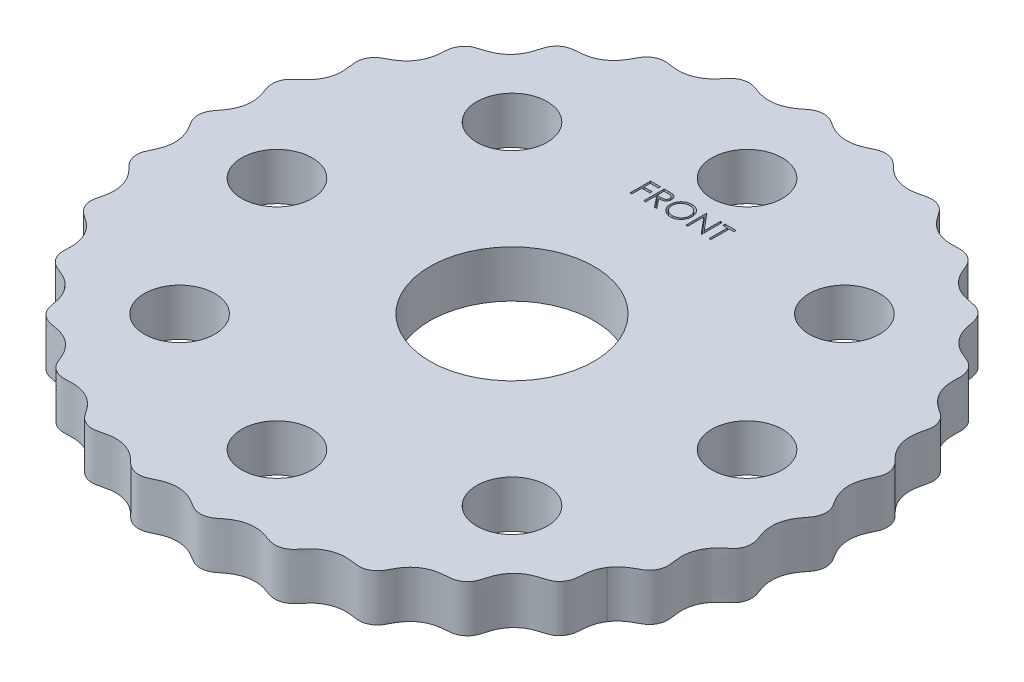
from build123d import *

# Parameters (mm, degrees)
BOSS_EXTRUDE1_DEPTH = 8
SKETCH3_R           = 13.975
SKETCH3_R_2         = 6
CUT_EXTRUDE1_DEPTH  = 80.602111677
CUT_EXTRUDE2_DEPTH  = 1


with BuildPart() as part:
    # Boss-Extrude1: read off the stored shape, not the designer's step
    # Boss-Extrude1 outline → Boss-Extrude1 (new body)
    with BuildSketch(Plane(origin=(0, 0, 0), x_dir=(1, 0, 0), z_dir=(0, 1, 0))):
        with BuildLine():
            add(Edge.make_bspline(
                [(45.452011393, -29.295396999), (45.482020207, -29.248838676), (45.539950378, -29.162318364), (45.690793525, -28.948505321), (45.945860987, -28.623186457), (46.519930798, -28.011988654), (47.291652745, -27.440896957), (48.131923542, -26.977086828), (48.780086514, -26.645059788), (49.38776392, -26.211455603), (50.035613, -25.454884874), (50.494850475, -24.256065773), (50.276789439, -22.77633474), (50.104474336, -21.357743007), (50.269796954, -19.920016676), (50.769712821, -18.569861894), (51.582970862, -17.373442214), (52.638109876, -16.40818839), (53.798010715, -15.474073004), (54.398237755, -14.052797744), (54.288242379, -12.788844058), (53.936943004, -11.878053184), (53.691639282, -11.201454425), (53.502016764, -10.508166169), (53.348681094, -9.563709411), (53.365752469, -8.362214318), (53.736623243, -6.967831783), (54.311860092, -5.913554711), (54.883090058, -5.142725575), (55.340751713, -4.578997497), (55.737538775, -3.949015301), (56.052730778, -3.00188621), (56.025620148, -1.985315879), (55.649644456, -1.061104039), (55.122864038, -0.240134624), (54.500638717, 0.782820357), (54.044556858, 2.153494538), (53.928329594, 3.589569405), (54.163281961, 5.016105688), (54.712144707, 6.338029285), (55.412584997, 7.646381686), (55.437790296, 9.187808634), (54.735024872, 10.54181705), (53.639118394, 11.510323523), (52.771830413, 12.658437238), (52.180323553, 13.974054615), (51.929405012, 15.394952627), (52.007688372, 16.593339305), (52.206190075, 17.531817872), (52.394523489, 18.231098314), (52.520927557, 18.962794769), (52.455506926, 19.959202548), (52.045558264, 20.889312064), (51.348722995, 21.604575131), (50.537370244, 22.152468312), (49.543409202, 22.819381701), (48.553261077, 23.871542755), (47.841768495, 25.124517383), (47.455397201, 26.517005342), (47.394149547, 27.948505123), (47.52261616, 29.422226755), (46.968961031, 30.857027514), (45.808285231, 31.8535888), (44.408884991, 32.298430416), (43.140404019, 32.972958337), (42.048757909, 33.917677709), (41.224521321, 35.099939242), (40.696031584, 36.444617259), (40.51608949, 37.629027207), (40.301720063, 38.591301743), (39.864677347, 39.48992174), (39.133325258, 40.194876492), (38.218073131, 40.595606327), (37.253580175, 40.782846618), (36.071300828, 40.970873882), (34.730638, 41.509718514), (33.556725898, 42.345495693), (32.620960719, 43.445774876), (31.960045306, 44.719085871), (31.494328922, 46.117687905), (30.446430109, 47.237781564), (28.993407958, 47.72966066), (27.527409538, 47.575965637), (26.09477545, 47.65212614), (24.706256084, 48.049924523), (23.460272332, 48.773879165), (22.415834948, 49.772324046), (21.756309533, 50.771411807), (21.18743939, 51.572468485), (20.444467382, 52.240500735), (19.500388916, 52.615401554), (18.501488434, 52.642279486), (17.536585409, 52.440079118), (16.383589539, 52.114801947), (14.940682821, 52.040769245), (13.523552592, 52.303161906), (12.212320575, 52.907196355), (11.074130719, 53.783867641), (10.091039504, 54.874622372), (8.704064767, 55.520076288), (7.1686916, 55.431701854), (5.879593477, 54.706045456), (4.550582563, 54.170624607), (3.122828399, 53.947415169), (1.687859842, 54.077924066), (0.320695311, 54.545147358), (-0.697186076, 55.174948414), (-1.531265128, 55.687584796), (-2.470477662, 56.026791538), (-3.486865599, 56.015990022), (-4.421336869, 55.664035314), (-5.035502665, 55.246714903), (-5.594575696, 54.786390441), (-6.367297701, 54.218019531), (-7.426377738, 53.651796586), (-8.824065069, 53.293493528), (-10.266531357, 53.288855582), (-11.670341095, 53.604558747), (-13.005004357, 54.202638527), (-14.528387878, 54.283429423), (-15.921788506, 53.62383615), (-16.824045224, 52.445566546), (-17.80129743, 51.399751347), (-19.003455996, 50.596627626), (-20.359323515, 50.109373145), (-21.796017134, 49.958739694), (-22.984604633, 50.102696542), (-23.949938492, 50.243667024), (-24.94676167, 50.204247475), (-25.883921729, 49.809140233), (-26.616265738, 49.130849265), (-27.026032174, 48.509246894), (-27.350515124, 47.859681973), (-27.816620118, 47.021077593), (-28.539207375, 46.061783917), (-29.655952484, 45.148142237), (-30.743142683, 44.636385074), (-31.666616638, 44.385977082), (-32.376331518, 44.272346807), (-33.093840777, 44.216319001), (-34.068415009, 44.160093251), (-35.264956472, 43.738229889), (-36.31143808, 42.604577354), (-36.683107055, 41.162427233), (-37.126430474, 39.802832151), (-37.880177694, 38.568055674), (-38.903346828, 37.555159171), (-40.144455104, 36.810820906), (-41.507578213, 36.381880712), (-42.945266896, 35.969336398), (-43.847405921, 35.055934649), (-44.268863223, 34.153490056), (-44.412643136, 33.420966547), (-44.447421794, 32.693522882), (-44.522839391, 31.736704546), (-44.72421652, 30.798023635), (-45.043766236, 30.022778058), (-45.234706871, 29.65611949), (-45.367135582, 29.430438722), (-45.422004001, 29.341953117), (-45.452011393, 29.295396999)],
                knots=[0.068442981, 0.068442981, 0.068442981, 0.068442981, 0.069285866, 0.07012875, 0.07181452, 0.075186058, 0.081929134, 0.085300673, 0.088672211, 0.092043749, 0.095415287, 0.102158364, 0.108901441, 0.115644517, 0.122387594, 0.12913067, 0.135873747, 0.142616823, 0.1493599, 0.156102976, 0.162846053, 0.166217591, 0.16958913, 0.172960668, 0.176332206, 0.183075283, 0.189818359, 0.196561436, 0.199932974, 0.203304512, 0.206676051, 0.210047589, 0.216790665, 0.220162204, 0.223533742, 0.230276819, 0.237019895, 0.243762972, 0.250506048, 0.257249125, 0.263992201, 0.270735278, 0.277478354, 0.284221431, 0.290964507, 0.297707584, 0.304450661, 0.311193737, 0.314565275, 0.317936814, 0.321308352, 0.32467989, 0.331422967, 0.334794505, 0.338166043, 0.34490912, 0.351652196, 0.358395273, 0.36513835, 0.371881426, 0.378624503, 0.385367579, 0.392110656, 0.398853732, 0.405596809, 0.412339885, 0.419082962, 0.425826039, 0.432569115, 0.435940653, 0.439312192, 0.446055268, 0.449426806, 0.452798345, 0.459541421, 0.466284498, 0.473027574, 0.479770651, 0.486513728, 0.493256804, 0.499999881, 0.506742957, 0.513486034, 0.52022911, 0.526972187, 0.533715263, 0.54045834, 0.547201417, 0.550572955, 0.553944493, 0.56068757, 0.564059108, 0.567430646, 0.574173723, 0.580916799, 0.587659876, 0.594402952, 0.601146029, 0.607889105, 0.614632182, 0.621375259, 0.628118335, 0.634861412, 0.641604488, 0.648347565, 0.655090641, 0.661833718, 0.665205256, 0.668576794, 0.675319871, 0.678691409, 0.682062948, 0.685434486, 0.688806024, 0.695549101, 0.702292177, 0.709035254, 0.71577833, 0.722521407, 0.729264483, 0.73600756, 0.742750637, 0.749493713, 0.75623679, 0.762979866, 0.769722943, 0.776466019, 0.779837558, 0.783209096, 0.789952172, 0.793323711, 0.796695249, 0.800066787, 0.803438326, 0.810181402, 0.816924479, 0.823667555, 0.827039093, 0.830410632, 0.83378217, 0.837153708, 0.843896785, 0.850639861, 0.857382938, 0.864126014, 0.870869091, 0.877612168, 0.884355244, 0.891098321, 0.897841397, 0.904584474, 0.907956012, 0.91132755, 0.914699089, 0.918070627, 0.924813703, 0.928185242, 0.929871011, 0.930713895, 0.93155678, 0.93155678, 0.93155678, 0.93155678], degree=3))
            add(Edge.make_bspline(
                [(-45.452011393, 29.295396999), (-45.482019477, 29.248839248), (-45.539947367, 29.162321464), (-45.690789371, 28.948508087), (-45.945856792, 28.623185577), (-46.519925191, 28.011983666), (-47.29164202, 27.440909837), (-48.131898599, 26.977058013), (-48.780039576, 26.644946563), (-49.387785704, 26.21146236), (-50.035599368, 25.454911063), (-50.494864672, 24.256064691), (-50.276802503, 22.776339405), (-50.104483942, 21.357748296), (-50.269799242, 19.920021004), (-50.769708571, 18.569863596), (-51.582961228, 17.373440464), (-52.638095451, 16.408181099), (-53.797999989, 15.474072119), (-54.398238796, 14.052802493), (-54.28825513, 12.788847524), (-53.936957446, 11.878054287), (-53.691651941, 11.201457093), (-53.502026507, 10.508168452), (-53.348686936, 9.563713445), (-53.365751967, 8.362219919), (-53.736619759, 6.967831949), (-54.311850704, 5.913561542), (-54.883092063, 5.142721386), (-55.340657861, 4.578932289), (-55.737530279, 3.949018779), (-56.052801709, 3.001912614), (-56.025579494, 1.985232731), (-55.649781289, 1.061119393), (-55.122707794, 0.240184662), (-54.500715895, -0.782845267), (-54.044549214, -2.15349866), (-53.928335645, -3.589565496), (-54.16327507, -5.016098662), (-54.71212817, -6.338033079), (-55.412573612, -7.646377904), (-55.437792443, -9.187804363), (-54.735039287, -10.541820251), (-53.639131433, -11.510327741), (-52.771838332, -12.658436844), (-52.180325197, -13.974051598), (-51.929399778, -15.394948334), (-52.007677663, -16.593335373), (-52.20617624, -17.531814556), (-52.394509, -18.231094687), (-52.520917845, -18.962789716), (-52.455505526, -19.959198126), (-52.045564115, -20.889310697), (-51.348734806, -21.604579831), (-50.537383212, -22.152476419), (-49.5434193, -22.819385473), (-48.553266484, -23.87154217), (-47.841767661, -25.124513292), (-47.455390134, -26.516999321), (-47.394135138, -27.948499239), (-47.522605986, -29.422219141), (-46.968964082, -30.85702387), (-45.808296742, -31.853596764), (-44.408895402, -32.298440075), (-43.140411621, -32.972961507), (-42.04876098, -33.917675929), (-41.22451857, -35.09993334), (-40.696022967, -36.444609077), (-40.516076102, -37.629018061), (-40.301712357, -38.591292823), (-39.864677196, -39.48991668), (-39.133331122, -40.194876089), (-38.218081268, -40.595615448), (-37.253590114, -40.782858733), (-36.071306144, -40.970886443), (-34.730639182, -41.509731233), (-33.556721074, -42.345495536), (-32.620976154, -43.445773487), (-31.959938524, -44.719063945), (-31.494447944, -46.117669084), (-30.446365425, -47.237822981), (-28.993474039, -47.729559685), (-27.527385182, -47.576071566), (-26.094782881, -47.652112284), (-24.706254032, -48.049928597), (-23.460261037, -48.773872439), (-22.415825504, -49.772313607), (-21.756302398, -50.771397329), (-21.187434253, -51.572456885), (-20.444470002, -52.240495153), (-19.500393308, -52.615403393), (-18.501493228, -52.642289829), (-17.536588061, -52.44009475), (-16.383593294, -52.114812823), (-14.940686933, -52.040773813), (-13.523555358, -52.30315944), (-12.212320701, -52.907187688), (-11.07412608, -53.783853705), (-10.091036883, -54.874608128), (-8.704069276, -55.520074615), (-7.168694262, -55.431713954), (-5.879592797, -54.706060727), (-4.55058507, -54.170633211), (-3.122831736, -53.947417258), (-1.687862569, -54.077918973), (-0.320696001, -54.545136147), (0.697188163, -55.17493276), (1.53126456, -55.687571624), (2.470473996, -56.026786372), (3.486862141, -56.015992795), (4.42133629, -55.664045996), (5.035505387, -55.246729387), (5.594578429, -54.7864042), (6.367298562, -54.218030678), (7.426375978, -53.651802856), (8.824061607, -53.293492944), (10.266527679, -53.288848133), (11.670339516, -53.604544662), (13.005001256, -54.202623602), (14.528383006, -54.283428933), (15.921789742, -53.623847936), (16.824055556, -52.445579942), (17.801293851, -51.399760376), (19.003449862, -50.596623521), (20.359330313, -50.109378115), (21.796007811, -49.958658751), (22.984623467, -50.102859067), (23.949867836, -50.243548365), (24.946854017, -50.204249861), (25.883868277, -49.809086397), (26.616266038, -49.130858381), (27.026130366, -48.509305428), (27.350518172, -47.859678415), (27.816617782, -47.021088942), (28.539208609, -46.061787098), (29.655947461, -45.148144871), (30.743136422, -44.636381206), (31.666610338, -44.385968876), (32.37632365, -44.272336062), (33.09383359, -44.216305956), (34.068406349, -44.160082772), (35.264951533, -43.738230817), (36.311443319, -42.604586841), (36.683119802, -41.16243747), (37.126436071, -39.802840285), (37.880177826, -38.56806028), (38.90334177, -37.55515882), (40.144446079, -36.810814196), (41.507568283, -36.381870467), (42.945261745, -35.969322941), (43.847387605, -35.055957981), (44.268848121, -34.153473192), (44.412765821, -33.420962722), (44.447458549, -32.693533894), (44.522832253, -31.736719823), (44.724223439, -30.798026917), (45.043768778, -30.022781604), (45.234706012, -29.656124644), (45.367133838, -29.430442917), (45.422003637, -29.341954262), (45.452011393, -29.295396999)],
                knots=[0.068443102, 0.068443102, 0.068443102, 0.068443102, 0.069285987, 0.070128871, 0.07181464, 0.075186179, 0.081929255, 0.085300793, 0.088672332, 0.09204387, 0.095415408, 0.102158485, 0.108901561, 0.115644638, 0.122387714, 0.129130791, 0.135873867, 0.142616944, 0.14936002, 0.156103097, 0.162846174, 0.166217712, 0.16958925, 0.172960788, 0.176332327, 0.183075403, 0.18981848, 0.196561556, 0.199933094, 0.203304633, 0.206676171, 0.210047709, 0.216790786, 0.220162324, 0.223533862, 0.230276939, 0.237020015, 0.243763092, 0.250506168, 0.257249245, 0.263992322, 0.270735398, 0.277478475, 0.284221551, 0.290964628, 0.297707704, 0.304450781, 0.311193857, 0.314565395, 0.317936934, 0.321308472, 0.32468001, 0.331423087, 0.334794625, 0.338166163, 0.34490924, 0.351652316, 0.358395393, 0.365138469, 0.371881546, 0.378624623, 0.385367699, 0.392110776, 0.398853852, 0.405596929, 0.412340005, 0.419083082, 0.425826158, 0.432569235, 0.435940773, 0.439312311, 0.446055388, 0.449426926, 0.452798464, 0.459541541, 0.466284617, 0.473027694, 0.479770771, 0.486513847, 0.493256924, 0.5, 0.506743077, 0.513486153, 0.52022923, 0.526972306, 0.533715383, 0.540458459, 0.547201536, 0.550573074, 0.553944612, 0.560687689, 0.564059227, 0.567430765, 0.574173842, 0.580916918, 0.587659995, 0.594403072, 0.601146148, 0.607889225, 0.614632301, 0.621375378, 0.628118454, 0.634861531, 0.641604607, 0.648347684, 0.65509076, 0.661833837, 0.665205375, 0.668576913, 0.67531999, 0.678691528, 0.682063066, 0.685434605, 0.688806143, 0.69554922, 0.702292296, 0.709035373, 0.715778449, 0.722521526, 0.729264602, 0.736007679, 0.742750755, 0.749493832, 0.756236908, 0.762979985, 0.769723061, 0.776466138, 0.779837676, 0.783209214, 0.789952291, 0.793323829, 0.796695367, 0.800066906, 0.803438444, 0.810181521, 0.816924597, 0.823667674, 0.827039212, 0.83041075, 0.833782288, 0.837153827, 0.843896903, 0.85063998, 0.857383056, 0.864126133, 0.870869209, 0.877612286, 0.884355362, 0.891098439, 0.897841515, 0.904584592, 0.90795613, 0.911327669, 0.914699207, 0.918070745, 0.924813822, 0.92818536, 0.929871129, 0.930714014, 0.931556896, 0.931556896, 0.931556896, 0.931556896], degree=3))
        make_face()
    extrude(amount=BOSS_EXTRUDE1_DEPTH)

    # Sketch3 → Cut-Extrude1 (cut, through all)
    with BuildSketch(Plane(origin=(0, 8, 0), x_dir=(1, 0, 0), z_dir=(0, 1, 0))):
        with Locations(Location((0, 0, 0), (0, 0, 270))):
            Circle(SKETCH3_R)
        with Locations(Location((0, 40, 0), (0, 0, 270))):
            Circle(SKETCH3_R_2)
        with Locations(Location((28.284271247, 28.284271247, 0), (0, 0, 270))):
            Circle(SKETCH3_R_2)
        with Locations(Location((40, 0, 0), (0, 0, 270))):
            Circle(SKETCH3_R_2)
        with Locations(Location((28.284271247, -28.284271247, 0), (0, 0, 270))):
            Circle(SKETCH3_R_2)
        with Locations(Location((0, -40, 0), (0, 0, 270))):
            Circle(SKETCH3_R_2)
        with Locations(Location((-28.284271247, -28.284271247, 0), (0, 0, 270))):
            Circle(SKETCH3_R_2)
        with Locations(Location((-40, 0, 0), (0, 0, 270))):
            Circle(SKETCH3_R_2)
        with Locations(Location((-28.284271247, 28.284271247, 0), (0, 0, 270))):
            Circle(SKETCH3_R_2)
    extrude(amount=-CUT_EXTRUDE1_DEPTH, mode=Mode.SUBTRACT)

    # Sketch4 → Cut-Extrude2 (cut)
    # profile 1 of 5: a face of its own
    with BuildSketch(Plane(origin=(0, 8, 0), x_dir=(1, 0, 0), z_dir=(0, 1, 0))):
        Polygon((-7.786271951, 31.356243312), (-6.081143746, 31.356243312), (-6.081143746, 30.997268953), (-7.472169387, 30.997268953), (-7.472169387, 29.920345876), (-6.081143746, 29.920345876), (-6.081143746, 29.561371517), (-7.472169387, 29.561371517), (-7.472169387, 27.856243312), (-7.786271951, 27.856243312), align=None)
    # profile 2 of 5: a face of its own
    with BuildSketch(Plane(origin=(0, 8, 0), x_dir=(1, 0, 0), z_dir=(0, 1, 0))):
        with BuildLine():
            Line((-5.452938618, 31.356243312), (-4.752517944, 31.356243312))
            add(Edge.make_bspline(
                [(-4.752517944, 31.356243312), (-4.705776816, 31.356087726), (-4.616028672, 31.355788984), (-4.487455401, 31.354123221), (-4.370628304, 31.349348865), (-4.265608465, 31.345240282), (-4.17239781, 31.33774834), (-4.090710519, 31.330587693), (-4.020922822, 31.321214032), (-3.97867697, 31.312508609), (-3.959549194, 31.30856703)],
                knots=[0, 0, 0, 0, 1.410062039, 2.707475311, 3.878576406, 4.937260626, 5.877586885, 6.699081471, 7.410979367, 8, 8, 8, 8], degree=3))
            add(Edge.make_bspline(
                [(-3.959549194, 31.30856703), (-3.93394257, 31.302240265), (-3.883275581, 31.289721701), (-3.810325515, 31.2632621), (-3.740811191, 31.232642475), (-3.675021367, 31.196678755), (-3.613285575, 31.155103975), (-3.554967265, 31.108635853), (-3.499801801, 31.057528647), (-3.450020171, 31.000493806), (-3.403081119, 30.940657296), (-3.363492493, 30.875953539), (-3.329366013, 30.808292012), (-3.302195496, 30.736984594), (-3.280317523, 30.662722822), (-3.264891283, 30.584834025), (-3.255640096, 30.50367305), (-3.25469824, 30.448315141), (-3.254220669, 30.420245716)],
                knots=[0, 0, 0, 0, 1.027469482, 2.033020251, 3.019912614, 3.986113645, 4.951240523, 5.91722682, 6.890402269, 7.87763091, 8.8651537, 9.85103654, 10.82876324, 11.815024772, 12.821070561, 13.842952187, 14.906261191, 16, 16, 16, 16], degree=3))
            add(Edge.make_bspline(
                [(-3.254220669, 30.420245716), (-3.255689667, 30.373610611), (-3.258556063, 30.282613443), (-3.285281166, 30.150552562), (-3.329057686, 30.027363247), (-3.389380975, 29.913200609), (-3.466200451, 29.810289964), (-3.558525242, 29.719899509), (-3.666406853, 29.644259596), (-3.766836169, 29.591806791), (-3.855550369, 29.558213883), (-3.928583682, 29.534577524), (-4.008250659, 29.516315559), (-4.093787994, 29.499955427), (-4.185551649, 29.487603732), (-4.283321689, 29.478557138), (-4.38716784, 29.472903089), (-4.45850691, 29.472061084), (-4.495206246, 29.471627927)],
                knots=[0, 0, 0, 0, 1.260483769, 2.459530307, 3.627416485, 4.787058657, 5.939039949, 7.08810263, 8.267026773, 9.491475466, 10.141966685, 10.831826277, 11.566392101, 12.351337768, 13.187381173, 14.07005841, 15.007169909, 16, 16, 16, 16], degree=3))
            Line((-4.495206246, 29.471627927), (-3.209348874, 27.856243312))
            Line((-3.209348874, 27.856243312), (-3.597770348, 27.856243312))
            Line((-3.597770348, 27.856243312), (-4.88362772, 29.471627927))
            Line((-4.88362772, 29.471627927), (-5.138836053, 29.471627927))
            Line((-5.138836053, 29.471627927), (-5.138836053, 27.856243312))
            Line((-5.138836053, 27.856243312), (-5.452938618, 27.856243312))
            Line((-5.452938618, 27.856243312), (-5.452938618, 31.356243312))
        make_face()
        with BuildLine():
            Line((-5.138836053, 30.997268953), (-5.138836053, 29.830602286))
            Line((-5.138836053, 29.830602286), (-4.498010733, 29.825694434))
            add(Edge.make_bspline(
                [(-4.498010733, 29.825694434), (-4.468090694, 29.825681197), (-4.410097137, 29.825655541), (-4.326196472, 29.829649317), (-4.24807636, 29.834192635), (-4.176035608, 29.841141981), (-4.110042033, 29.850098052), (-4.05012862, 29.861301037), (-3.996197568, 29.874353099), (-3.933299029, 29.894554725), (-3.863062498, 29.926560743), (-3.786731038, 29.973126242), (-3.7217287, 30.031695361), (-3.666810838, 30.098668817), (-3.622681407, 30.172305066), (-3.591569352, 30.251721435), (-3.57182691, 30.334913033), (-3.569498365, 30.392091141), (-3.568323233, 30.420946838)],
                knots=[0, 0, 0, 0, 1.146690395, 2.22261258, 3.21895312, 4.145990853, 4.996080663, 5.770904154, 6.481378293, 7.121626537, 8.300444488, 9.431385265, 10.535395872, 11.636531494, 12.74115979, 13.810798291, 14.895190096, 16, 16, 16, 16], degree=3))
            add(Edge.make_bspline(
                [(-3.568323233, 30.420946838), (-3.569525354, 30.449093411), (-3.571907519, 30.50486965), (-3.591356288, 30.58652556), (-3.624245669, 30.66359251), (-3.668567907, 30.735756995), (-3.722567062, 30.801262731), (-3.785884875, 30.857309884), (-3.85679007, 30.903559349), (-3.923061268, 30.93311373), (-3.982295481, 30.951233583), (-4.033725141, 30.963984747), (-4.091836619, 30.974229215), (-4.156912077, 30.982437276), (-4.228673708, 30.989492221), (-4.307484359, 30.994243999), (-4.392821139, 30.997057863), (-4.451968071, 30.997196952), (-4.482586053, 30.997268953)],
                knots=[0, 0, 0, 0, 1.101028733, 2.181837193, 3.264309656, 4.369019818, 5.486613113, 6.575447106, 7.666700264, 8.788928104, 9.402425223, 10.0903467, 10.862060571, 11.710948788, 12.657782767, 13.684531032, 14.801375019, 16, 16, 16, 16], degree=3))
            Line((-4.482586053, 30.997268953), (-5.138836053, 30.997268953))
        make_face(mode=Mode.SUBTRACT)
    # profile 3 of 5: a face of its own
    with BuildSketch(Plane(origin=(0, 8, 0), x_dir=(1, 0, 0), z_dir=(0, 1, 0))):
        with BuildLine():
            add(Edge.make_bspline(
                [(-0.853579643, 31.445986902), (-0.788771537, 31.444345422), (-0.66148307, 31.441121421), (-0.474408173, 31.416442318), (-0.295813077, 31.373746928), (-0.124242939, 31.316883945), (0.038250038, 31.24102956), (0.192888931, 31.149344412), (0.339305804, 31.040867953), (0.475527186, 30.916438726), (0.600184136, 30.781055272), (0.710010022, 30.636577362), (0.802052316, 30.48387856), (0.877638103, 30.323417729), (0.936936713, 30.155557761), (0.977855757, 29.979403758), (1.003993907, 29.796097068), (1.007049684, 29.671070204), (1.008599844, 29.607645556)],
                knots=[0, 0, 0, 0, 1.065120563, 2.091984664, 3.0946048, 4.079830382, 5.057816894, 6.036188127, 7.030412546, 8.04752943, 9.064399622, 10.05169764, 11.02544977, 11.989514704, 12.962713494, 13.945757189, 14.957906945, 16, 16, 16, 16], degree=3))
            add(Edge.make_bspline(
                [(1.008599844, 29.607645556), (1.007049911, 29.544688109), (1.003994815, 29.420591689), (0.977826037, 29.238448245), (0.936785037, 29.063357548), (0.878188771, 28.895611895), (0.802963293, 28.735034332), (0.710308122, 28.582047378), (0.601166911, 28.436600879), (0.47696006, 28.300288214), (0.341559018, 28.175290743), (0.196328751, 28.066371868), (0.044535431, 27.972647743), (-0.115774277, 27.897864069), (-0.282474314, 27.838092149), (-0.457056637, 27.797339519), (-0.638703191, 27.771052475), (-0.762574195, 27.768033959), (-0.825534771, 27.766499722)],
                knots=[0, 0, 0, 0, 1.043624062, 2.057103931, 3.04512605, 4.022047818, 4.998200453, 5.980619268, 6.982898556, 8.009068085, 9.034988726, 10.034168286, 11.015286542, 11.987931943, 12.962482838, 13.94673481, 14.956375938, 16, 16, 16, 16], degree=3))
            add(Edge.make_bspline(
                [(-0.825534771, 27.766499722), (-0.88895909, 27.768049109), (-1.013985306, 27.771103363), (-1.197522342, 27.797284768), (-1.373800086, 27.838226072), (-1.542314437, 27.896735508), (-1.703159366, 27.972352739), (-1.856649449, 28.064557118), (-2.002168596, 28.173964259), (-2.138510343, 28.298130833), (-2.263259541, 28.433302385), (-2.372018917, 28.57813664), (-2.46424403, 28.729792097), (-2.539607362, 28.888689621), (-2.599271822, 29.054061064), (-2.63997664, 29.227009541), (-2.666312592, 29.406549047), (-2.669347438, 29.528791946), (-2.670887336, 29.590818632)],
                knots=[0, 0, 0, 0, 1.053102029, 2.075944431, 3.073151272, 4.055350789, 5.033113405, 6.020478099, 7.024410459, 8.052272461, 9.079885166, 10.07527673, 11.055994387, 12.023226415, 12.992069828, 13.970394897, 14.97016774, 16, 16, 16, 16], degree=3))
            add(Edge.make_bspline(
                [(-2.670887336, 29.590818632), (-2.6703527, 29.632451302), (-2.669290174, 29.715191425), (-2.656498481, 29.838058025), (-2.63793678, 29.958948683), (-2.611334867, 30.077519631), (-2.5765432, 30.193480616), (-2.535491173, 30.307631379), (-2.485351328, 30.418815102), (-2.42867068, 30.527558494), (-2.365408872, 30.6321664), (-2.295533122, 30.731045983), (-2.221497754, 30.82502698), (-2.14033436, 30.911673984), (-2.054717915, 30.99350764), (-1.963259537, 31.069270357), (-1.866517292, 31.139645308), (-1.764074913, 31.203065649), (-1.658456638, 31.260424784), (-1.54957986, 31.309646635), (-1.438923288, 31.351892696), (-1.325968641, 31.386133521), (-1.211015868, 31.413165557), (-1.093814084, 31.431572911), (-0.974456658, 31.444397229), (-0.894045339, 31.445454731), (-0.853579643, 31.445986902)],
                knots=[0, 0, 0, 0, 1.037015668, 2.060948919, 3.074880161, 4.083647147, 5.086022904, 6.090072063, 7.104153813, 8.122640571, 9.144368836, 10.147691507, 11.138137339, 12.123020368, 13.103399296, 14.087645067, 15.080126199, 16.082011238, 17.087798457, 18.072939717, 19.057185487, 20.037253025, 21.01195951, 21.997135196, 22.992090687, 24, 24, 24, 24], degree=3))
        make_face()
        with BuildLine():
            add(Edge.make_bspline(
                [(-0.838154964, 31.087012543), (-0.871369597, 31.086607652), (-0.93748133, 31.085801743), (-1.035765866, 31.075186027), (-1.1327578, 31.060056138), (-1.228477162, 31.038474617), (-1.322523452, 31.009070565), (-1.415773293, 30.975229656), (-1.507376347, 30.934008566), (-1.597030205, 30.887435861), (-1.68394528, 30.835886941), (-1.765957981, 30.778915174), (-1.843280625, 30.717856619), (-1.915723892, 30.652568782), (-1.983075064, 30.58271918), (-2.046659766, 30.509366744), (-2.103929347, 30.430414853), (-2.156414924, 30.348004446), (-2.203382764, 30.262242865), (-2.245148119, 30.174033003), (-2.279312128, 30.082655316), (-2.307174504, 29.989101158), (-2.330274315, 29.893518699), (-2.344908239, 29.79518285), (-2.355640599, 29.694587738), (-2.356400444, 29.626605884), (-2.356784771, 29.592220876)],
                knots=[0, 0, 0, 0, 1.008559885, 2.007477868, 2.99961109, 3.989939068, 4.984837346, 5.991145699, 7.001802488, 8.033829008, 9.059044045, 10.069351652, 11.065060232, 12.050310815, 13.029377138, 14.011219647, 14.996725999, 15.989392538, 16.977580475, 17.965360261, 18.951710183, 19.937753436, 20.929683414, 21.935841486, 22.955955122, 24, 24, 24, 24], degree=3))
            add(Edge.make_bspline(
                [(-2.356784771, 29.592220876), (-2.355509909, 29.541658655), (-2.353001862, 29.442187125), (-2.331044291, 29.296418981), (-2.297222317, 29.156330695), (-2.247364951, 29.022688785), (-2.185014336, 28.894344503), (-2.107987446, 28.772436398), (-2.01672836, 28.656931524), (-1.913064833, 28.548636255), (-1.799742127, 28.44979045), (-1.679409397, 28.363027042), (-1.553355789, 28.289616792), (-1.421252587, 28.22981172), (-1.283805048, 28.182421982), (-1.140127497, 28.149943351), (-0.991177037, 28.128567895), (-0.889646382, 28.126515139), (-0.838154964, 28.125474081)],
                knots=[0, 0, 0, 0, 1.032063989, 2.030389145, 3.003944642, 3.970395727, 4.937377036, 5.913328081, 6.909231446, 7.93887556, 8.970685674, 9.976071282, 10.964166581, 11.944589148, 12.933237628, 13.927779006, 14.949070134, 16, 16, 16, 16], degree=3))
            add(Edge.make_bspline(
                [(-0.838154964, 28.125474081), (-0.803545462, 28.125949586), (-0.734904426, 28.126892654), (-0.632808903, 28.13639133), (-0.532552692, 28.1516232), (-0.434276412, 28.173553855), (-0.3380916, 28.201001062), (-0.243596797, 28.23360879), (-0.151798507, 28.274289993), (-0.061538669, 28.319237945), (0.024857573, 28.370478103), (0.107333105, 28.425516252), (0.183809085, 28.486484873), (0.256198156, 28.550802685), (0.323825845, 28.619766533), (0.386234829, 28.693286755), (0.443214961, 28.771827412), (0.495680608, 28.854112818), (0.542483871, 28.940109071), (0.58326297, 29.028638749), (0.617859086, 29.119483858), (0.645787591, 29.21277543), (0.667673052, 29.308336278), (0.682752972, 29.406294357), (0.693301411, 29.506453699), (0.694096488, 29.574197555), (0.69449728, 29.608346677)],
                knots=[0, 0, 0, 0, 1.047197238, 2.076906641, 3.100256066, 4.114471768, 5.12198147, 6.126382909, 7.136867548, 8.15857795, 9.17633901, 10.174870724, 11.156907918, 12.133735059, 13.104061851, 14.077631395, 15.04955518, 16.038496417, 17.029181396, 18.010275684, 18.986308667, 19.968651475, 20.955262928, 21.950658345, 22.966943676, 24, 24, 24, 24], degree=3))
            add(Edge.make_bspline(
                [(0.69449728, 29.608346677), (0.694096167, 29.642262182), (0.693300485, 29.709539832), (0.682758011, 29.80900065), (0.66765712, 29.906253862), (0.645894412, 30.000917665), (0.617844259, 30.09301619), (0.583256928, 30.182462937), (0.542471629, 30.269591132), (0.495663404, 30.354185429), (0.443047581, 30.435360167), (0.385553338, 30.51296258), (0.322187989, 30.585535321), (0.254761965, 30.654870015), (0.181591079, 30.719487905), (0.103006785, 30.779410426), (0.019963107, 30.8360837), (-0.067964128, 30.887209262), (-0.158708082, 30.934423494), (-0.25182204, 30.974874498), (-0.346251139, 31.009246617), (-0.441755252, 31.038563582), (-0.53913823, 31.059971612), (-0.637742059, 31.075199662), (-0.737430317, 31.085798048), (-0.804473537, 31.086606426), (-0.838154964, 31.087012543)],
                knots=[0, 0, 0, 0, 1.02996197, 2.043119294, 3.035359645, 4.018872909, 4.991431989, 5.957985074, 6.929999688, 7.912076566, 8.892894881, 9.867085534, 10.843653904, 11.817741046, 12.803660682, 13.806313499, 14.818574707, 15.856120519, 16.894564902, 17.924820532, 18.937903209, 19.946497019, 20.957711757, 21.963978472, 22.977135795, 24, 24, 24, 24], degree=3))
        make_face(mode=Mode.SUBTRACT)
    # profile 4 of 5: a face of its own
    with BuildSketch(Plane(origin=(0, 8, 0), x_dir=(1, 0, 0), z_dir=(0, 1, 0))):
        Polygon((1.726548562, 27.856243312), (1.726548562, 31.356243312), (1.792454011, 31.356243312), (4.10475369, 28.60153578), (4.10475369, 31.356243312), (4.418856254, 31.356243312), (4.418856254, 27.856243312), (4.347341831, 27.856243312), (2.040651126, 30.604640748), (2.040651126, 27.856243312), align=None)
    # profile 5 of 5: a face of its own
    with BuildSketch(Plane(origin=(0, 8, 0), x_dir=(1, 0, 0), z_dir=(0, 1, 0))):
        Polygon((4.912445998, 30.997268953), (4.912445998, 31.356243312), (6.752189588, 31.356243312), (6.752189588, 30.997268953), (5.989369075, 30.997268953), (5.989369075, 27.856243312), (5.675266511, 27.856243312), (5.675266511, 30.997268953), align=None)
    extrude(amount=-CUT_EXTRUDE2_DEPTH, mode=Mode.SUBTRACT)


solid = part.part
